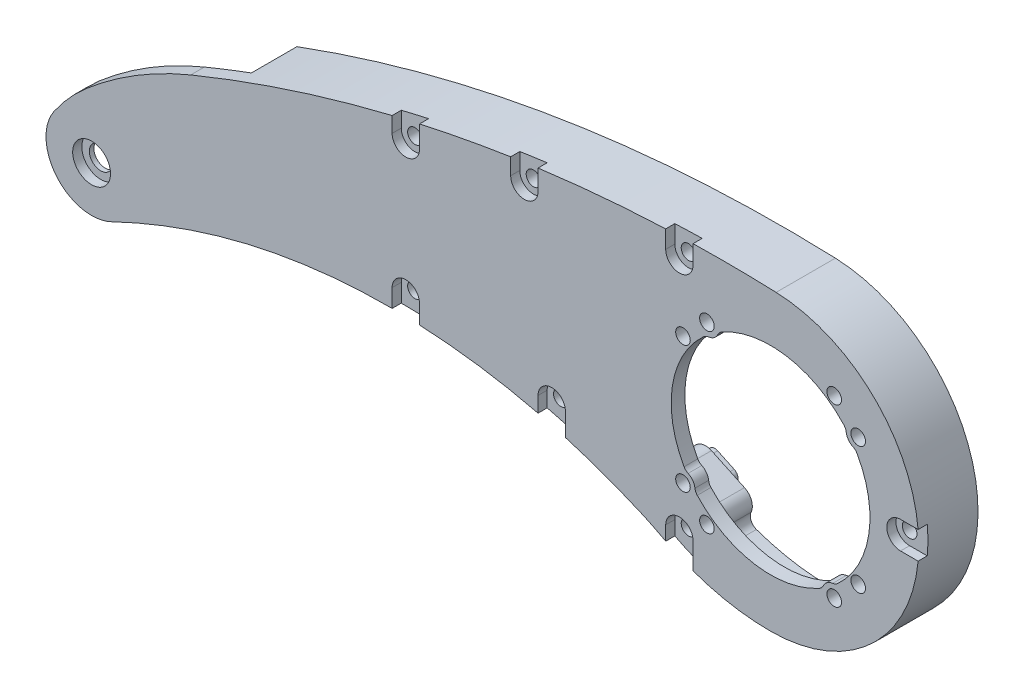
from build123d import *

# Parameters (mm, degrees)
SKETCH_1_R          = 1.6
EXTRUDE_1_DEPTH     = 3
EXTRUDE_START       = 10
SKETCH_2_R          = 1.6
EXTRUDE_2_DEPTH     = 10
EXTRUDE_3_DEPTH     = 2
CUT_EXTRUDE_1_REACH = 164.764
SKETCH_5_R          = 1.6
CUT_EXTRUDE_4_REACH = 164.687
SKETCH_10_R         = 2.5
SKETCH_11_R         = 4.15
CUT_EXTRUDE_5_DEPTH = 2
CUT_EXTRUDE_START   = -2
SKETCH_13_R         = 1.6
CUT_EXTRUDE_6_DEPTH = 2
EXTRUDE_START_2     = 1.5
SKETCH_14_R         = 10
SKETCH_14_R_2       = 7
EXTRUDE_4_DEPTH     = 1.5


with BuildPart() as part:
    # 草图1 → 凸台-拉伸1 (new body)
    with BuildSketch(Plane.XY):
        with BuildLine():
            ThreePointArc((-23.6380873, -26.566491362), (-12.185705724, -30.993964901), (0, -32.5))
            ThreePointArc((0, -32.5), (32.494299771, -0.608672659), (1.217131806, 32.477201083))
            ThreePointArc((1.217131806, 32.477201083), (-64.206902417, 27.922113621), (-127.172269011, 9.580475598))
            ThreePointArc((-127.172269011, 9.580475598), (-139.222290641, 3.45440527), (-150.14384136, -4.511239012))
            ThreePointArc((-150.14384136, -4.511239012), (-153.910924638, -8.201852374), (-157.1671235, -12.350190882))
            ThreePointArc((-157.1671235, -12.350190882), (-156.816374649, -24.130693578), (-145.491863518, -27.395462511))
            ThreePointArc((-145.491863518, -27.395462511), (-145.026167645, -27.212412967), (-144.570211335, -27.006297405))
            ThreePointArc((-144.570211335, -27.006297405), (-136.08176084, -23.223756861), (-127.379272112, -19.963680984))
            ThreePointArc((-127.379272112, -19.963680984), (-77.471346593, -12.811545944), (-28.370763381, -24.26086005))
            ThreePointArc((-28.370763381, -24.26086005), (-25.98221149, -25.368078233), (-23.6380873, -26.566491362))
        make_face()
        with BuildLine():
            ThreePointArc((18.083792076, 11.563072091), (18.591300533, 11.22000242), (18.971162667, 10.73941279))
            ThreePointArc((18.971162667, 10.73941279), (21.531605825, -3.410271338), (14.723986814, -16.076200182))
            ThreePointArc((14.723986814, -16.076200182), (14.214206094, -16.415884227), (13.62552251, -16.585334135))
            ThreePointArc((13.62552251, -16.585334135), (12.402268823, -17.070258581), (11.563072091, -18.083792076))
            ThreePointArc((11.563072091, -18.083792076), (11.22000242, -18.591300533), (10.73941279, -18.971162667))
            ThreePointArc((10.73941279, -18.971162667), (-3.410271338, -21.531605825), (-16.076200182, -14.723986814))
            ThreePointArc((-16.076200182, -14.723986814), (-16.415884227, -14.214206094), (-16.585334135, -13.62552251))
            ThreePointArc((-16.585334135, -13.62552251), (-17.070258581, -12.402268823), (-18.083792076, -11.563072091))
            ThreePointArc((-18.083792076, -11.563072091), (-18.591300533, -11.22000242), (-18.971162667, -10.73941279))
            ThreePointArc((-18.971162667, -10.73941279), (-21.531605825, 3.410271338), (-14.723986814, 16.076200182))
            ThreePointArc((-14.723986814, 16.076200182), (-14.214206094, 16.415884227), (-13.62552251, 16.585334135))
            ThreePointArc((-13.62552251, 16.585334135), (-12.402268823, 17.070258581), (-11.563072091, 18.083792076))
            ThreePointArc((-11.563072091, 18.083792076), (-11.22000242, 18.591300533), (-10.73941279, 18.971162667))
            ThreePointArc((-10.73941279, 18.971162667), (3.410271338, 21.531605825), (16.076200182, 14.723986814))
            ThreePointArc((16.076200182, 14.723986814), (16.415884227, 14.214206094), (16.585334135, 13.62552251))
            ThreePointArc((16.585334135, 13.62552251), (17.070258581, 12.402268823), (18.083792076, 11.563072091))
        make_face(mode=Mode.SUBTRACT)
        with Locations((-13.959899742, -19.214153616)):
            Circle(SKETCH_1_R, mode=Mode.SUBTRACT)
        with Locations((13.959899742, -19.214153616)):
            Circle(SKETCH_1_R, mode=Mode.SUBTRACT)
        with Locations((-19.214153616, -13.959899742)):
            Circle(SKETCH_1_R, mode=Mode.SUBTRACT)
        with Locations((19.214153616, -13.959899742)):
            Circle(SKETCH_1_R, mode=Mode.SUBTRACT)
        with Locations((-19.214153616, 13.959899742)):
            Circle(SKETCH_1_R, mode=Mode.SUBTRACT)
        with Locations((19.214153616, 13.959899742)):
            Circle(SKETCH_1_R, mode=Mode.SUBTRACT)
        with Locations((-13.959899742, 19.214153616)):
            Circle(SKETCH_1_R, mode=Mode.SUBTRACT)
        with Locations((13.959899742, 19.214153616)):
            Circle(SKETCH_1_R, mode=Mode.SUBTRACT)
    extrude(amount=EXTRUDE_1_DEPTH)

    # 草图2 → 凸台-拉伸2 (add)
    with BuildSketch(Plane(origin=(0, 0, 0), x_dir=(-1, 0, 0), z_dir=(0, 0, -1)).offset(EXTRUDE_START)):
        with BuildLine():
            ThreePointArc((17.001102074, 28.618241459), (17.803337861, 26.493729725), (19.86429336, 25.540002931))
            Line((19.86429336, 25.540002931), (27.856104149, 25.178118556))
            ThreePointArc((27.856104149, 25.178118556), (29.994821549, 25.941676183), (30.985784325, 27.98498848))
            ThreePointArc((30.985784325, 27.98498848), (31.663067744, 29.355553639), (33.113908291, 29.837449265))
            ThreePointArc((33.113908291, 29.837449265), (41.227314196, 29.119699609), (49.318671562, 28.185646114))
            ThreePointArc((49.318671562, 28.185646114), (50.642440563, 27.420925697), (51.029255455, 25.941893607))
            ThreePointArc((51.029255455, 25.941893607), (51.587558118, 23.740659748), (53.528225459, 22.561277437))
            Line((53.528225459, 22.561277437), (61.428685658, 21.303211995))
            ThreePointArc((61.428685658, 21.303211995), (63.63968675, 21.821484643), (64.854085448, 23.740434399))
            ThreePointArc((64.854085448, 23.740434399), (65.681160173, 25.026167296), (67.176979656, 25.341897814))
            ThreePointArc((67.176979656, 25.341897814), (71.378861197, 24.513870134), (75.568707204, 23.626949189))
            ThreePointArc((75.568707204, 23.626949189), (76.820720374, 22.749666619), (77.077039123, 21.242529471))
            ThreePointArc((77.077039123, 21.242529471), (77.441191522, 19.000984157), (79.271578812, 17.656806068))
            Line((79.271578812, 17.656806068), (87.032175615, 15.714349565))
            ThreePointArc((87.032175615, 15.714349565), (89.279958958, 16.037772516), (90.657125441, 17.843470399))
            ThreePointArc((90.657125441, 17.843470399), (91.593206584, 19.052153062), (93.11086617, 19.236193992))
            ThreePointArc((93.11086617, 19.236193992), (103.776807204, 16.016684998), (114.31810295, 12.409938501))
            ThreePointArc((114.31810295, 12.409938501), (115.844352177, 12.477074745), (116.877933734, 13.602087253))
            ThreePointArc((116.877933734, 13.602087253), (58.758007498, 28.843357745), (-1.217131806, 32.477201083))
            ThreePointArc((-1.217131806, 32.477201083), (-32.494299771, -0.608672659), (0, -32.5))
            ThreePointArc((0, -32.5), (12.185705724, -30.993964901), (23.6380873, -26.566491362))
            ThreePointArc((23.6380873, -26.566491362), (25.98221149, -25.368078233), (28.370763381, -24.26086005))
            ThreePointArc((28.370763381, -24.26086005), (67.447729657, -13.61728358), (107.927773367, -14.906110424))
            ThreePointArc((107.927773367, -14.906110424), (107.695689541, -13.31299597), (106.364851219, -12.407045681))
            ThreePointArc((106.364851219, -12.407045681), (99.844973908, -11.340589455), (93.285564935, -10.553009015))
            ThreePointArc((93.285564935, -10.553009015), (91.744551116, -9.844486263), (90.969936637, -8.335612348))
            ThreePointArc((90.969936637, -8.335612348), (89.970871928, -6.49701406), (88.012925285, -5.758760104))
            Line((88.012925285, -5.758760104), (80.013000401, -5.724092368))
            ThreePointArc((80.013000401, -5.724092368), (77.84660248, -6.635313587), (77.001817369, -8.828471625))
            ThreePointArc((77.001817369, -8.828471625), (76.473178092, -10.269527622), (75.088620305, -10.932175043))
            ThreePointArc((75.088620305, -10.932175043), (68.061013416, -11.534031926), (61.073151389, -12.492820013))
            ThreePointArc((61.073151389, -12.492820013), (59.57674153, -12.150972965), (58.744053794, -10.861502918))
            ThreePointArc((58.744053794, -10.861502918), (57.437519935, -8.907897702), (55.123740646, -8.49555141))
            Line((55.123740646, -8.49555141), (47.327397155, -10.289158996))
            ThreePointArc((47.327397155, -10.289158996), (45.426416956, -11.671142477), (45.104931619, -13.999285781))
            ThreePointArc((45.104931619, -13.999285781), (44.919437274, -15.522996291), (43.722847368, -16.484388233))
            ThreePointArc((43.722847368, -16.484388233), (38.132797804, -18.285074645), (32.624096936, -20.321085557))
            ThreePointArc((32.624096936, -20.321085557), (31.089233, -20.303922581), (30.002334443, -19.220062167))
            ThreePointArc((30.002334443, -19.220062167), (28.311680005, -17.587490076), (25.963057786, -17.674540277))
            Line((25.963057786, -17.674540277), (18.723451368, -21.078669963))
            ThreePointArc((18.723451368, -21.078669963), (17.187310183, -22.750078076), (17.261694817, -25.018954835))
            ThreePointArc((17.261694817, -25.018954835), (17.275070203, -26.622295223), (16.106540278, -27.720210117))
            ThreePointArc((16.106540278, -27.720210117), (8.172329404, -29.799953184), (0, -30.5))
            ThreePointArc((0, -30.5), (-19.662506126, -23.315999932), (-30.062360099, -5.148252645))
            ThreePointArc((-30.062360099, -5.148252645), (-29.685338806, -3.685938076), (-28.342105263, -2.995841994))
            ThreePointArc((-28.342105263, -2.995841994), (-25.5, 0), (-28.342105263, 2.995841994))
            ThreePointArc((-28.342105263, 2.995841994), (-29.685338806, 3.685938076), (-30.062360099, 5.148252645))
            ThreePointArc((-30.062360099, 5.148252645), (-20.095728615, 22.943663427), (-1.142231387, 30.478604093))
            ThreePointArc((-1.142231387, 30.478604093), (6.952265997, 30.674453283), (15.049110071, 30.655457646))
            ThreePointArc((15.049110071, 30.655457646), (16.450460044, 30.044409415), (17.001102074, 28.618241459))
        make_face()
        with Locations((20, -23.793522369)):
            Circle(SKETCH_2_R, mode=Mode.SUBTRACT)
        with Locations((-28.5, 0)):
            Circle(SKETCH_2_R, mode=Mode.SUBTRACT)
        with Locations((48, -13.212787805)):
            Circle(SKETCH_2_R, mode=Mode.SUBTRACT)
        with Locations((80, -8.724064199)):
            Circle(SKETCH_2_R, mode=Mode.SUBTRACT)
        with Locations((20, 28.536931977)):
            Circle(SKETCH_2_R, mode=Mode.SUBTRACT)
        with Locations((54, 25.523950011)):
            Circle(SKETCH_2_R, mode=Mode.SUBTRACT)
        with Locations((80, 20.567029869)):
            Circle(SKETCH_2_R, mode=Mode.SUBTRACT)
    extrude(amount=-EXTRUDE_2_DEPTH)

    # 草图4 → 凸台-拉伸3 (add)
    with BuildSketch(Plane(origin=(0, 0, -10), x_dir=(-1, 0, 0), z_dir=(0, 0, -1))):
        with BuildLine():
            Line((24.258077525, -23.44888373), (27.877880734, -21.746818887))
            ThreePointArc((27.877880734, -21.746818887), (28.597032621, -19.751118368), (26.601332102, -19.031966481))
            Line((26.601332102, -19.031966481), (22.981528893, -20.734031323))
            ThreePointArc((22.981528893, -20.734031323), (22.262377006, -22.729731843), (24.258077525, -23.44888373))
        make_face()
        with BuildLine():
            Line((23.928052075, 26.857525267), (27.92395747, 26.67658308))
            ThreePointArc((27.92395747, 26.67658308), (29.490275313, 28.107194282), (28.05966411, 29.673512126))
            Line((28.05966411, 29.673512126), (24.063758715, 29.854454313))
            ThreePointArc((24.063758715, 29.854454313), (22.497440872, 28.42384311), (23.928052075, 26.857525267))
        make_face()
        with BuildLine():
            Line((83.516087807, 18.140689717), (87.396386209, 17.169461466))
            ThreePointArc((87.396386209, 17.169461466), (89.215708703, 18.260362772), (88.124807397, 20.079685267))
            Line((88.124807397, 20.079685267), (84.244508996, 21.050913518))
            ThreePointArc((84.244508996, 21.050913518), (82.425186501, 19.960012212), (83.516087807, 18.140689717))
        make_face()
        with BuildLine():
            Line((83.993462241, -10.241383983), (87.993424683, -10.258717851))
            ThreePointArc((87.993424683, -10.258717851), (89.4999108, -8.765232136), (88.006425084, -7.25874602))
            Line((88.006425084, -7.25874602), (84.006462642, -7.241412152))
            ThreePointArc((84.006462642, -7.241412152), (82.499976526, -8.734897867), (83.993462241, -10.241383983))
        make_face()
        with BuildLine():
            Line((52.234473168, -13.777798416), (56.132644913, -12.880994623))
            ThreePointArc((56.132644913, -12.880994623), (57.258157895, -11.082878796), (55.460042069, -9.957365814))
            Line((55.460042069, -9.957365814), (51.561870323, -10.854169607))
            ThreePointArc((51.561870323, -10.854169607), (50.436357341, -12.652285434), (52.234473168, -13.777798416))
        make_face()
        with BuildLine():
            Line((57.714342829, 23.413581003), (61.664572928, 22.784548282))
            ThreePointArc((61.664572928, 22.784548282), (63.381796485, 24.029997299), (62.136347469, 25.747220857))
            Line((62.136347469, 25.747220857), (58.186117369, 26.376253578))
            ThreePointArc((58.186117369, 26.376253578), (56.468893812, 25.130804561), (57.714342829, 23.413581003))
        make_face()
    extrude(amount=EXTRUDE_3_DEPTH)

    # 草图5 → 切除-拉伸1 (cut, up to next)
    with BuildSketch(Plane(origin=(0, 0, -10), x_dir=(-1, 0, 0), z_dir=(0, 0, -1)), mode=Mode.PRIVATE) as cut_extrude_1_sk1:
        with Locations((-28.5, 0)):
            Circle(SKETCH_5_R)
    cut_extrude_1_tool1 = extrude(cut_extrude_1_sk1.sketch, amount=-CUT_EXTRUDE_1_REACH, mode=Mode.PRIVATE) & part.part
    # 草图5 → 切除-拉伸1 (cut, up to next)
    with BuildSketch(Plane(origin=(0, 0, -10), x_dir=(-1, 0, 0), z_dir=(0, 0, -1)), mode=Mode.PRIVATE) as cut_extrude_1_sk2:
        with Locations((80, -8.724064199)):
            Circle(SKETCH_5_R)
    cut_extrude_1_tool2 = extrude(cut_extrude_1_sk2.sketch, amount=-CUT_EXTRUDE_1_REACH, mode=Mode.PRIVATE) & part.part
    # 草图5 → 切除-拉伸1 (cut, up to next)
    with BuildSketch(Plane(origin=(0, 0, -10), x_dir=(-1, 0, 0), z_dir=(0, 0, -1)), mode=Mode.PRIVATE) as cut_extrude_1_sk3:
        with Locations((54, 25.523950011)):
            Circle(SKETCH_5_R)
    cut_extrude_1_tool3 = extrude(cut_extrude_1_sk3.sketch, amount=-CUT_EXTRUDE_1_REACH, mode=Mode.PRIVATE) & part.part
    # 草图5 → 切除-拉伸1 (cut, up to next)
    with BuildSketch(Plane(origin=(0, 0, -10), x_dir=(-1, 0, 0), z_dir=(0, 0, -1)), mode=Mode.PRIVATE) as cut_extrude_1_sk4:
        with Locations((80, 20.567029869)):
            Circle(SKETCH_5_R)
    cut_extrude_1_tool4 = extrude(cut_extrude_1_sk4.sketch, amount=-CUT_EXTRUDE_1_REACH, mode=Mode.PRIVATE) & part.part
    # 草图5 → 切除-拉伸1 (cut, up to next)
    with BuildSketch(Plane(origin=(0, 0, -10), x_dir=(-1, 0, 0), z_dir=(0, 0, -1)), mode=Mode.PRIVATE) as cut_extrude_1_sk5:
        with Locations((48, -13.212787805)):
            Circle(SKETCH_5_R)
    cut_extrude_1_tool5 = extrude(cut_extrude_1_sk5.sketch, amount=-CUT_EXTRUDE_1_REACH, mode=Mode.PRIVATE) & part.part
    # 草图5 → 切除-拉伸1 (cut, up to next)
    with BuildSketch(Plane(origin=(0, 0, -10), x_dir=(-1, 0, 0), z_dir=(0, 0, -1)), mode=Mode.PRIVATE) as cut_extrude_1_sk6:
        with Locations((20, -23.793522369)):
            Circle(SKETCH_5_R)
    cut_extrude_1_tool6 = extrude(cut_extrude_1_sk6.sketch, amount=-CUT_EXTRUDE_1_REACH, mode=Mode.PRIVATE) & part.part
    # 草图5 → 切除-拉伸1 (cut, up to next)
    with BuildSketch(Plane(origin=(0, 0, -10), x_dir=(-1, 0, 0), z_dir=(0, 0, -1)), mode=Mode.PRIVATE) as cut_extrude_1_sk7:
        with Locations((20, 28.536931977)):
            Circle(SKETCH_5_R)
    cut_extrude_1_tool7 = extrude(cut_extrude_1_sk7.sketch, amount=-CUT_EXTRUDE_1_REACH, mode=Mode.PRIVATE) & part.part
    add(cut_extrude_1_tool1.solids().sort_by_distance((28.5, 0, -10))[0], mode=Mode.SUBTRACT)
    add(cut_extrude_1_tool2.solids().sort_by_distance((-80, -8.724064, -10))[0], mode=Mode.SUBTRACT)
    add(cut_extrude_1_tool3.solids().sort_by_distance((-54, 25.52395, -10))[0], mode=Mode.SUBTRACT)
    add(cut_extrude_1_tool4.solids().sort_by_distance((-80, 20.56703, -10))[0], mode=Mode.SUBTRACT)
    add(cut_extrude_1_tool5.solids().sort_by_distance((-48, -13.212788, -10))[0], mode=Mode.SUBTRACT)
    add(cut_extrude_1_tool6.solids().sort_by_distance((-20, -23.793522, -10))[0], mode=Mode.SUBTRACT)
    add(cut_extrude_1_tool7.solids().sort_by_distance((-20, 28.536932, -10))[0], mode=Mode.SUBTRACT)

    # 草图10 → 切除-拉伸4 (cut, up to next)
    with BuildSketch(Plane(origin=(0, 0, 0), x_dir=(-1, 0, 0), z_dir=(0, 0, -1)), mode=Mode.PRIVATE) as cut_extrude_4_sk1:
        with Locations((148.916083752, -18)):
            Circle(SKETCH_10_R)
    cut_extrude_4_tool1 = extrude(cut_extrude_4_sk1.sketch, amount=-CUT_EXTRUDE_4_REACH, mode=Mode.PRIVATE) & part.part
    add(cut_extrude_4_tool1.solids().sort_by_distance((-148.916084, -18, 0))[0], mode=Mode.SUBTRACT)

    # 草图11 → 切除-拉伸5 (cut)
    with BuildSketch(Plane.XY.offset(3)):
        with Locations((-148.916083752, -18)):
            Circle(SKETCH_11_R)
    extrude(amount=-CUT_EXTRUDE_5_DEPTH, mode=Mode.SUBTRACT)

    # 草图13 → 切除-拉伸6 (cut)
    # profile 1 of 7: a face of its own
    with BuildSketch(Plane.XY.offset(3).offset(CUT_EXTRUDE_START)):
        with BuildLine():
            ThreePointArc((-83, -12.683698856), (-79.999180454, -12.725284006), (-77, -12.832819462))
            Line((-77, -12.832819462), (-77, -8.724064199))
            ThreePointArc((-77, -8.724064199), (-80, -5.724064199), (-83, -8.724064199))
            Line((-83, -8.724064199), (-83, -12.683698856))
        make_face()
        with Locations((-80, -8.724064199)):
            Circle(SKETCH_13_R, mode=Mode.SUBTRACT)
    # profile 2 of 7: a face of its own
    with BuildSketch(Plane.XY.offset(3).offset(CUT_EXTRUDE_START)):
        with BuildLine():
            ThreePointArc((-51, -16.581282722), (-47.990836106, -17.352586143), (-45, -18.1921549))
            Line((-45, -18.1921549), (-45, -13.212787805))
            ThreePointArc((-45, -13.212787805), (-48, -10.212787805), (-51, -13.212787805))
            Line((-51, -13.212787805), (-51, -16.581282722))
        make_face()
        with Locations((-48, -13.212787805)):
            Circle(SKETCH_13_R, mode=Mode.SUBTRACT)
    # profile 3 of 7: a face of its own
    with BuildSketch(Plane.XY.offset(3).offset(CUT_EXTRUDE_START)):
        with BuildLine():
            ThreePointArc((-23, -26.902477601), (-20.04292434, -28.311736195), (-17, -29.524550153))
            Line((-17, -29.524550153), (-17, -23.793522369))
            ThreePointArc((-17, -23.793522369), (-20, -20.793522369), (-23, -23.793522369))
            Line((-23, -23.793522369), (-23, -26.902477601))
        make_face()
        with Locations((-20, -23.793522369)):
            Circle(SKETCH_13_R, mode=Mode.SUBTRACT)
    # profile 4 of 7: a face of its own
    with BuildSketch(Plane.XY.offset(3).offset(CUT_EXTRUDE_START)):
        with BuildLine():
            ThreePointArc((32.361242251, -3), (32.5, 0), (32.361242251, 3))
            Line((32.361242251, 3), (28.5, 3))
            ThreePointArc((28.5, 3), (25.5, 0), (28.5, -3))
            Line((28.5, -3), (32.361242251, -3))
        make_face()
        with Locations((28.5, 0)):
            Circle(SKETCH_13_R, mode=Mode.SUBTRACT)
    # profile 5 of 7: a face of its own
    with BuildSketch(Plane.XY.offset(3).offset(CUT_EXTRUDE_START)):
        with BuildLine():
            ThreePointArc((-17, 32.619234927), (-20.000463964, 32.53894641), (-23, 32.429338848))
            Line((-23, 32.429338848), (-23, 28.536931977))
            ThreePointArc((-23, 28.536931977), (-20, 25.536931977), (-17, 28.536931977))
            Line((-17, 28.536931977), (-17, 32.619234927))
        make_face()
        with Locations((-20, 28.536931977)):
            Circle(SKETCH_13_R, mode=Mode.SUBTRACT)
    # profile 6 of 7: a face of its own
    with BuildSketch(Plane.XY.offset(3).offset(CUT_EXTRUDE_START)):
        with BuildLine():
            ThreePointArc((-51, 29.981954991), (-54.002128749, 29.565339979), (-57, 29.119119123))
            Line((-57, 29.119119123), (-57, 25.523950011))
            ThreePointArc((-57, 25.523950011), (-54, 22.523950011), (-51, 25.523950011))
            Line((-51, 25.523950011), (-51, 29.981954991))
        make_face()
        with Locations((-54, 25.523950011)):
            Circle(SKETCH_13_R, mode=Mode.SUBTRACT)
    # profile 7 of 7: a face of its own
    with BuildSketch(Plane.XY.offset(3).offset(CUT_EXTRUDE_START)):
        with BuildLine():
            Line((-83, 23.960592486), (-83, 20.567029869))
            ThreePointArc((-83, 20.567029869), (-80, 17.567029869), (-77, 20.567029869))
            Line((-77, 20.567029869), (-77, 25.359108824))
            ThreePointArc((-77, 25.359108824), (-80.003506771, 24.674895616), (-83, 23.960592486))
        make_face()
        with Locations((-80, 20.567029869)):
            Circle(SKETCH_13_R, mode=Mode.SUBTRACT)
    extrude(amount=CUT_EXTRUDE_6_DEPTH, mode=Mode.SUBTRACT)

    # 草图14 → 凸台-拉伸4 (add)
    with BuildSketch(Plane(origin=(0, 0, 0), x_dir=(-1, 0, 0), z_dir=(0, 0, -1)).offset(EXTRUDE_START_2)):
        with Locations((148.916083752, -18)):
            Circle(SKETCH_14_R)
        with Locations((148.916083752, -18)):
            Circle(SKETCH_14_R_2, mode=Mode.SUBTRACT)
    extrude(amount=-EXTRUDE_4_DEPTH)


solid = part.part
